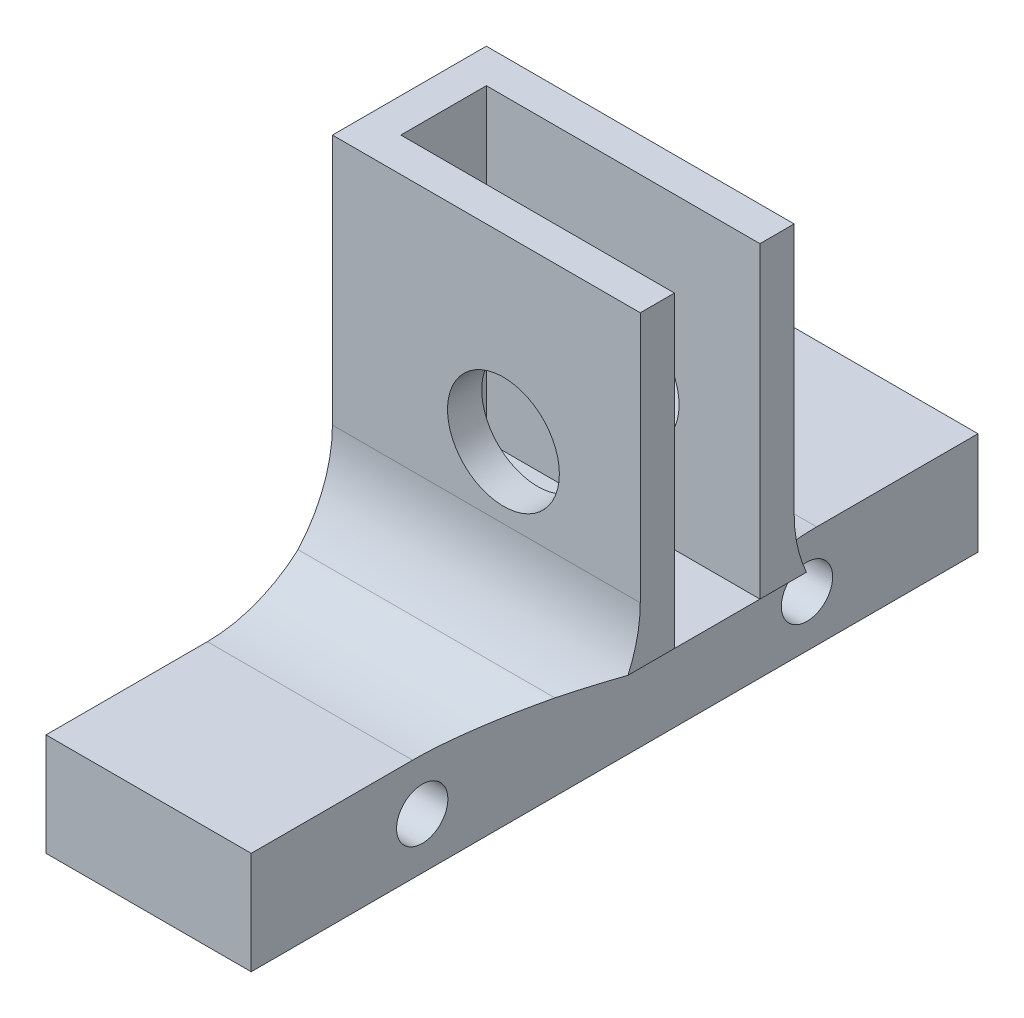
from build123d import *

# Parameters (mm, degrees)
BOSS_EXTRU_1_DEPTH           = 42.5
D_GAGEMENT_M31_D             = 3
BOSS_EXTRU_2_DEPTH           = 18
ESQUISSE7_R                  = 3.27
ENL_V_MAT_EXTRU_1_DEPTH      = 80.23684853
ENL_V_MAT_EXTRU_2_DEPTH      = 87.149089751
ENL_V_MAT_EXTRU_3_DEPTH      = 78.939140419
ENL_V_MAT_EXTRU_3_DEPTH_BACK = 78.939140419
CONG_4_R                     = 8


with BuildPart() as part:
    # Esquisse1 → Boss.-Extru.1 (new body)
    with BuildSketch(Plane(origin=(0, 0, 0), x_dir=(1, 0, 0), z_dir=(0, 0, -1))):
        Polygon((-1.384510159, -46.220398701), (38.615489841, -46.220398701), (38.615489841, -42.220398701), (24.615489841, -42.220398701), (24.615489841, -36.220398701), (12.615489841, -36.220398701), (12.615489841, -42.220398701), (-1.384510159, -42.220398701), align=None)
    extrude(amount=BOSS_EXTRU_1_DEPTH)

    # Dégagement M31 (through all)
    with Locations(Plane(origin=(24.615489841, 0, 0), x_dir=(0, 0, -1), z_dir=(1, 0, 0))):
        with Locations((10, 39.220398701), (32.5, 39.220398701)):
            Hole(D_GAGEMENT_M31_D / 2)

    # Esquisse6 → Boss.-Extru.2 (add)
    with BuildSketch(Plane(origin=(0, 46.220398701, 0), x_dir=(1, 0, 0), z_dir=(0, 1, 0))):
        Polygon((30.615489841, 23.75), (14.615489841, 23.75), (14.615489841, 18.75), (30.615489841, 18.75), (30.615489841, 16.75), (12.615489841, 16.75), (12.615489841, 25.75), (30.615489841, 25.75), align=None)
    extrude(amount=BOSS_EXTRU_2_DEPTH)

    # Esquisse7 → Enlèv. mat.-Extru.1 (cut, through all)
    with BuildSketch(Plane.XY.offset(-16.75)):
        with Locations((22.615489841, 53.690398701)):
            Circle(ESQUISSE7_R)
    extrude(amount=-ENL_V_MAT_EXTRU_1_DEPTH, mode=Mode.SUBTRACT)

    # Esquisse8 → Enlèv. mat.-Extru.2 (cut, through all)
    with BuildSketch(Plane.XY):
        Polygon((30.615489841, 46.220398701), (24.615489841, 42.220398701), (24.615489841, 36.220398701), (12.615489841, 36.220398701), (12.615489841, 42.220398701), (12.615489841, 46.220398701), (-1.384510159, 46.220398701), (-1.384510159, 34.129389344), (38.615489841, 34.129389344), (38.615489841, 46.220398701), align=None)
    extrude(amount=-ENL_V_MAT_EXTRU_2_DEPTH, mode=Mode.SUBTRACT)

    # Esquisse9 → Enlèv. mat.-Extru.3 (cut, two sides: drawn at the far end of the back side and taken through both)
    with BuildSketch(Plane(origin=(24.615489841, 0, 0), x_dir=(0, 0, -1), z_dir=(1, 0, 0)).offset(-ENL_V_MAT_EXTRU_3_DEPTH_BACK)):
        Polygon((16.75, 46.220398701), (12.75, 42.220398701), (0, 42.220398701), (0, 46.220398701), align=None)
        Polygon((25.75, 46.220398701), (29.75, 42.220398701), (42.5, 42.220398701), (42.5, 46.220398701), align=None)
    extrude(amount=ENL_V_MAT_EXTRU_3_DEPTH + ENL_V_MAT_EXTRU_3_DEPTH_BACK, mode=Mode.SUBTRACT)

    # Congé4
    # the kernel refuses this fillet: 8 mm, written as the material it adds along each edge
    with BuildSketch(Plane(origin=(32.899761088, 42.220398701, -12.75), x_dir=(0, 0.7071067811865437, -0.7071067811865512), z_dir=(-1, 0, 0))) as cong_4_piece_1_section:
        with BuildLine():
            CenterArc((CONG_4_R * 0.414213562373, -CONG_4_R), CONG_4_R, 90, 45)
            Line((-CONG_4_R * 0.292893218813, -CONG_4_R * 0.292893218813), (0, 0))
            Line((0, 0), (CONG_4_R * 0.414213562373, 0))
        make_face()
    cong_4_piece_1 = extrude(amount=20.284271247, mode=Mode.PRIVATE)
    cong_4_piece_1 = split(cong_4_piece_1, bisect_by=Plane(origin=(25.761131429, 42.984159759, -13.773553438), z_dir=(-0.5547001962252294, 0.8320502943378435, 0)), keep=Keep.TOP, mode=Mode.PRIVATE)
    cong_4_piece_1 = split(cong_4_piece_1, bisect_by=Plane(origin=(24.615489841, 43.38850385, -13.773553438), z_dir=(1, 0, 0)), keep=Keep.TOP, mode=Mode.PRIVATE)
    add(cong_4_piece_1)
    with BuildSketch(Plane(origin=(24.615489841, 42.220398701, -12.75), x_dir=(0, 0.7071067811865432, -0.7071067811865518), z_dir=(-1, 0, 0))) as cong_4_piece_2_section:
        with BuildLine():
            CenterArc((CONG_4_R * 0.414213562373, -CONG_4_R), CONG_4_R, 90, 45)
            Line((-CONG_4_R * 0.292893218813, -CONG_4_R * 0.292893218813), (0, 0))
            Line((0, 0), (CONG_4_R * 0.414213562373, 0))
        make_face()
    cong_4_piece_2 = extrude(amount=12, mode=Mode.PRIVATE)
    cong_4_piece_2 = split(cong_4_piece_2, bisect_by=Plane(origin=(20.681270928, 39.597586092, -12.548310033), z_dir=(-0.5547001962252294, 0.8320502943378435, 0)), keep=Keep.TOP, mode=Mode.PRIVATE)
    add(cong_4_piece_2)
    with BuildSketch(Plane(origin=(30.615489841, 46.220398701, -16.75), x_dir=(0, 1, 0), z_dir=(-1, 0, 0))) as cong_4_piece_3_section:
        with BuildLine():
            CenterArc((CONG_4_R * 0.414213562373, -CONG_4_R), CONG_4_R, 90, 45)
            Line((-CONG_4_R * 0.292893218813, -CONG_4_R * 0.292893218813), (0, 0))
            Line((0, 0), (CONG_4_R * 0.414213562373, 0))
        make_face()
    cong_4_piece_3 = extrude(amount=18, mode=Mode.PRIVATE)
    cong_4_piece_3 = split(cong_4_piece_3, bisect_by=Plane(origin=(24.307561612, 42.015113215, -16.286257704), z_dir=(-0.5547001962252294, 0.8320502943378435, 0)), keep=Keep.TOP, mode=Mode.PRIVATE)
    add(cong_4_piece_3)
    with BuildSketch(Plane(origin=(12.615489841, 46.220398701, -25.75), x_dir=(0, 1, 0), z_dir=(1, 0, 0))) as cong_4_piece_4_section:
        with BuildLine():
            CenterArc((CONG_4_R * 0.414213562373, -CONG_4_R), CONG_4_R, 90, 45)
            Line((-CONG_4_R * 0.292893218813, -CONG_4_R * 0.292893218813), (0, 0))
            Line((0, 0), (CONG_4_R * 0.414213562373, 0))
        make_face()
    cong_4_piece_4 = extrude(amount=18, mode=Mode.PRIVATE)
    cong_4_piece_4 = split(cong_4_piece_4, bisect_by=Plane(origin=(24.307561612, 42.015113215, -26.213742296), z_dir=(-0.5547001962252294, 0.8320502943378435, 0)), keep=Keep.TOP, mode=Mode.PRIVATE)
    add(cong_4_piece_4)
    with BuildSketch(Plane(origin=(12.615489841, 42.220398701, -29.75), x_dir=(0, 0.7071067811865519, 0.7071067811865432), z_dir=(1, 0, 0))) as cong_4_piece_5_section:
        with BuildLine():
            CenterArc((CONG_4_R * 0.414213562373, -CONG_4_R), CONG_4_R, 90, 45)
            Line((-CONG_4_R * 0.292893218813, -CONG_4_R * 0.292893218813), (0, 0))
            Line((0, 0), (CONG_4_R * 0.414213562373, 0))
        make_face()
    cong_4_piece_5 = extrude(amount=12, mode=Mode.PRIVATE)
    cong_4_piece_5 = split(cong_4_piece_5, bisect_by=Plane(origin=(20.681270928, 39.597586092, -29.951689967), z_dir=(-0.5547001962252294, 0.8320502943378435, 0)), keep=Keep.TOP, mode=Mode.PRIVATE)
    add(cong_4_piece_5)
    with BuildSketch(Plane(origin=(12.615489841, 42.220398701, -29.75), x_dir=(0, 0.7071067811865519, 0.7071067811865432), z_dir=(1, 0, 0))) as cong_4_piece_6_section:
        with BuildLine():
            CenterArc((CONG_4_R * 0.414213562373, -CONG_4_R), CONG_4_R, 90, 45)
            Line((-CONG_4_R * 0.292893218813, -CONG_4_R * 0.292893218813), (0, 0))
            Line((0, 0), (CONG_4_R * 0.414213562373, 0))
        make_face()
    cong_4_piece_6 = extrude(amount=20.284271247, mode=Mode.PRIVATE)
    cong_4_piece_6 = split(cong_4_piece_6, bisect_by=Plane(origin=(25.761131429, 42.984159759, -28.726446562), z_dir=(-0.5547001962252294, 0.8320502943378435, 0)), keep=Keep.TOP, mode=Mode.PRIVATE)
    cong_4_piece_6 = split(cong_4_piece_6, bisect_by=Plane(origin=(24.615489841, 43.38850385, -28.726446562), z_dir=(1, 0, 0)), keep=Keep.TOP, mode=Mode.PRIVATE)
    add(cong_4_piece_6)


solid = part.part
